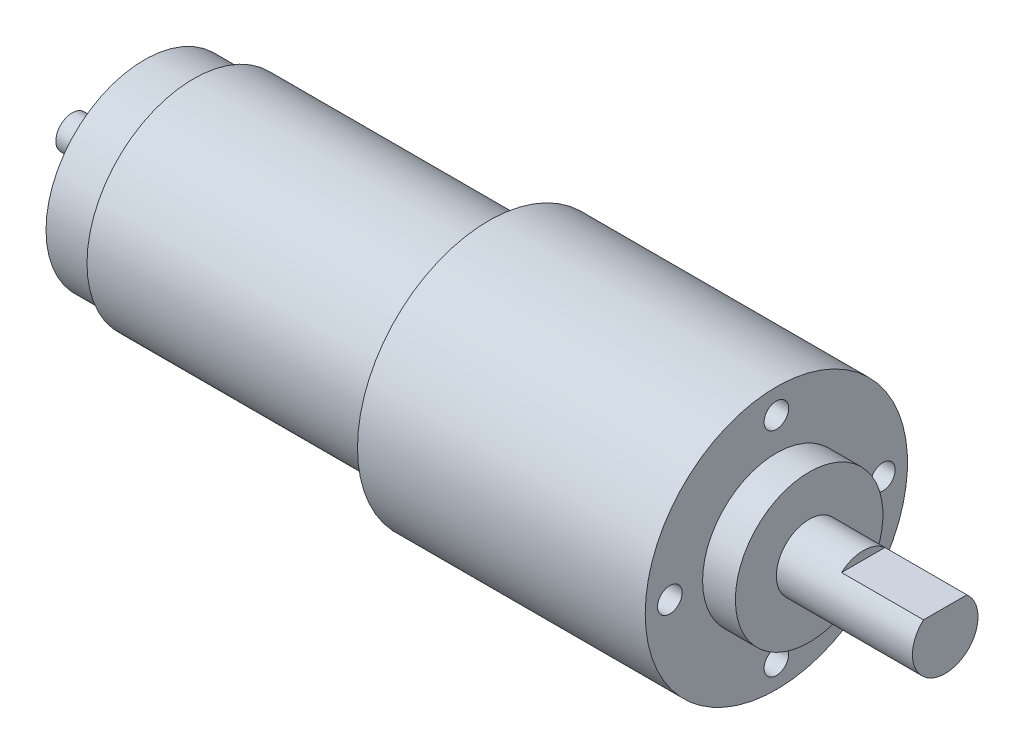
from build123d import *

# Parameters (mm, degrees)
ESQUISSE2_W             = 5.291502622
ESQUISSE2_H             = 1
ENL_V_MAT_EXTRU_1_DEPTH = 10
ESQUISSE3_R             = 1.5
FIXHOLES_DEPTH          = 3
REPEATFIXHOLES_COUNT    = 4


with BuildPart() as part:
    # Esquisse1 → MainRevolution (revolve)
    with BuildSketch(Plane.XY):
        Polygon((0, 0), (106.5, 0), (106.5, 4), (89.9, 4), (89.9, 9), (85.9, 9), (85.9, 16), (50.8, 16), (50.8, 13), (14.8, 13), (14.8, 12), (8.8, 12), (8.8, 2), (0, 2), align=None)
    revolve(axis=Axis((0, 0, 0), (1, 0, 0)))

    # Esquisse2 → Enlèv. mat.-Extru.1 (cut)
    with BuildSketch(Plane(origin=(106.5, 0, 0), x_dir=(0, 0, -1), z_dir=(1, 0, 0))):
        with Locations((0, 3.5)):
            Rectangle(ESQUISSE2_W, ESQUISSE2_H)
    extrude(amount=-ENL_V_MAT_EXTRU_1_DEPTH, mode=Mode.SUBTRACT)

    # Esquisse3 → FixHoles (cut)
    with BuildSketch(Plane(origin=(85.9, 0, 0), x_dir=(0, 0, -1), z_dir=(1, 0, 0))):
        with Locations((0, 13)):
            Circle(ESQUISSE3_R)
    fixholes = extrude(amount=-FIXHOLES_DEPTH, mode=Mode.SUBTRACT)

    # RepeatFixHoles: FixHoles ×4 about axis
    repeatfixholes_axis = Axis((-5.325, 0, 0), (1, 0, 0))
    for i in range(1, REPEATFIXHOLES_COUNT):
        add(fixholes.rotate(repeatfixholes_axis, i * 360 / REPEATFIXHOLES_COUNT), mode=Mode.SUBTRACT)


solid = part.part
